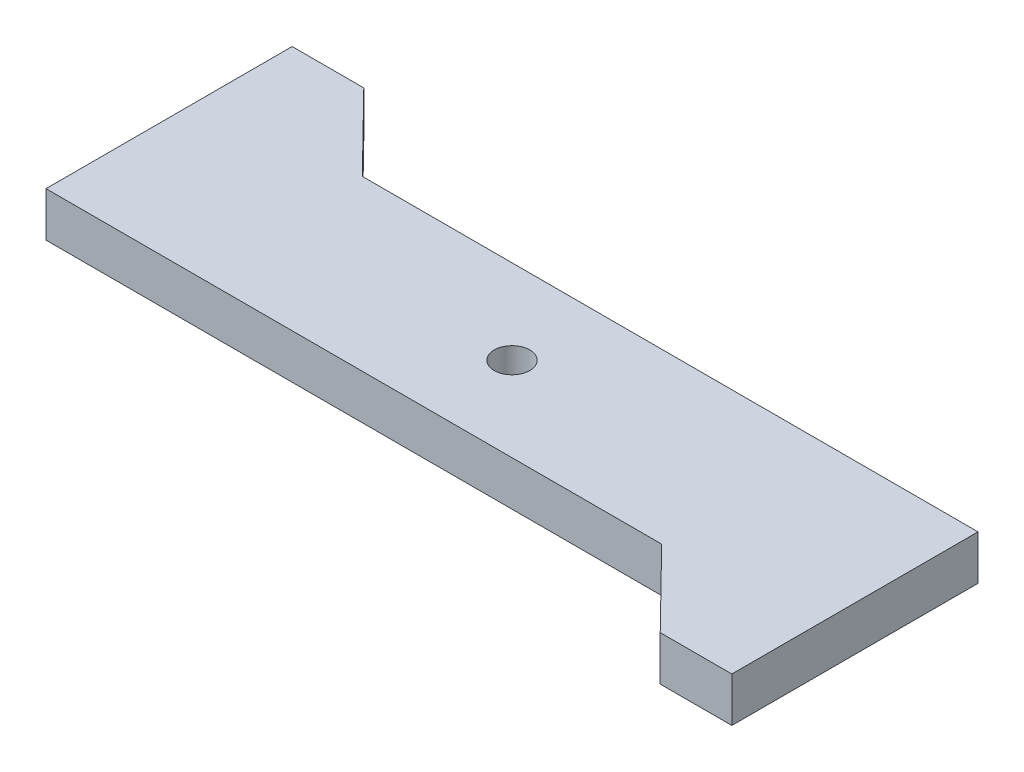
from build123d import *

# Parameters (mm, degrees)
BOSS_EXTRUDE1_DEPTH = 10
SKETCH2_R           = 4
CUT_EXTRUDE1_DEPTH  = 20


with BuildPart() as part:
    # Sketch1 → Boss-Extrude1 (new body)
    with BuildSketch(Plane(origin=(0, 0, 0), x_dir=(1, 0, 0), z_dir=(0, 1, 0))):
        Polygon((-85.536120369, 18.915289152), (-85.536120369, -18.915289152), (52.463879631, -18.915289152), (69.484000539, -36.260475895), (85.536120369, -36.260475895), (85.536120369, -18.915289152), (85.536120369, 18.915289152), (-52.463879631, 18.915289152), (-69.484000539, 36.260475895), (-85.536120369, 36.260475895), align=None)
    extrude(amount=BOSS_EXTRUDE1_DEPTH)

    # Sketch2 → Cut-Extrude1 (cut)
    with BuildSketch(Plane(origin=(0, 10, 0), x_dir=(1, 0, 0), z_dir=(0, 1, 0))):
        Circle(SKETCH2_R)
    extrude(amount=-CUT_EXTRUDE1_DEPTH, mode=Mode.SUBTRACT)


solid = part.part
